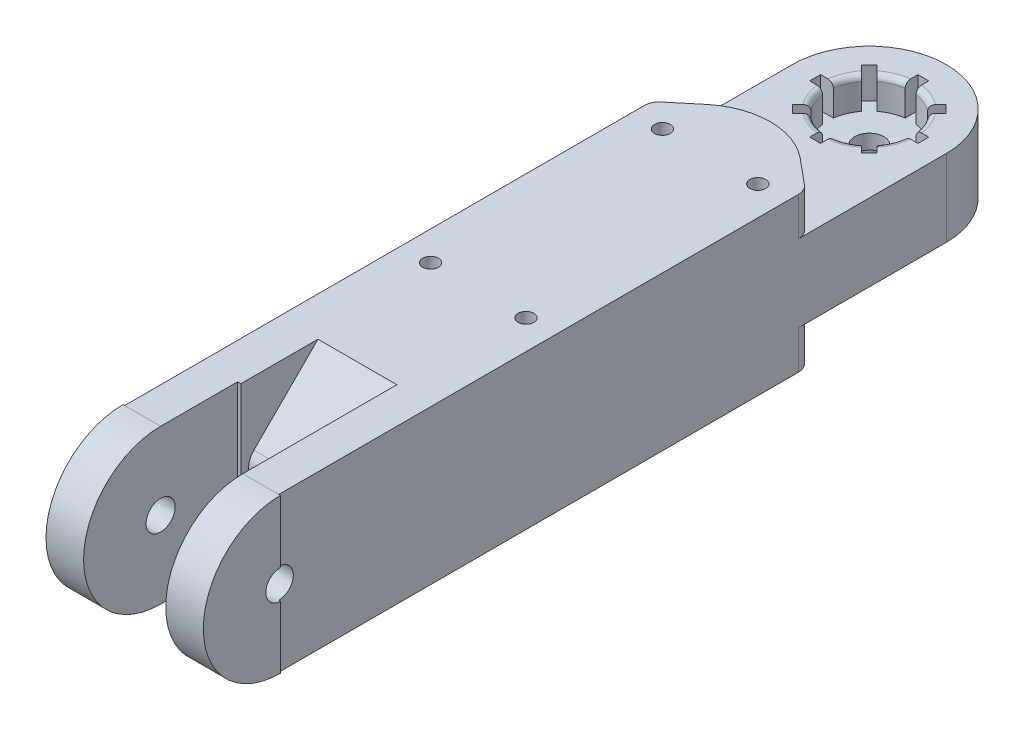
from build123d import *

# Parameters (mm, degrees)
SKETCH1_W                = 42
SKETCH1_H                = 42
BOSS_EXTRUDE1_DEPTH      = 140
SKETCH2_W                = 9.8
SKETCH2_H                = 42
BOSS_EXTRUDE2_DEPTH      = 21
BOSS_EXTRUDE4_DEPTH      = 10.25
BOSS_EXTRUDE5_START      = -10.25
BOSS_EXTRUDE5_DEPTH      = 10.25
SKETCH6_R                = 3.975
CUT_EXTRUDE1_DEPTH       = 187.094122691
SKETCH8_R                = 3.975
CUT_EXTRUDE2_DEPTH       = 187.094122691
SKETCH9_W                = 42
SKETCH9_H                = 21
BOSS_EXTRUDE6_DEPTH      = 21
BOSS_EXTRUDE7_DEPTH      = 21
SKETCH11_R               = 11.35
CUT_EXTRUDE3_DEPTH       = 8.5
CUT_EXTRUDE4_DEPTH       = 21.5
FILLET1_R                = 5
CUT_EXTRUDE5_START       = -8.5
SKETCH18_R               = 11.35
CUT_EXTRUDE5_DEPTH       = 8.5
SKETCH19_R               = 3.975
CUT_EXTRUDE6_DEPTH       = 8.5
FILLET4_R                = 1.5
FILLET5_R                = 1.5
SKETCH20_W               = 2.96
SKETCH20_H               = 3.81
CUT_EXTRUDE7_DEPTH       = 8.5
CIRPATTERN1_COUNT        = 8
MIRROR1_COPY_1_SKETCH_W  = 2.96
MIRROR1_COPY_1_SKETCH_H  = 3.81
MIRROR1_COPY_1_DEPTH     = 8.5
MIRROR1_COPY_2_SKETCH_W  = 2.96
MIRROR1_COPY_2_SKETCH_H  = 3.81
MIRROR1_COPY_2_DEPTH     = 8.5
MIRROR1_COPY_3_SKETCH_W  = 2.96
MIRROR1_COPY_3_SKETCH_H  = 3.81
MIRROR1_COPY_3_DEPTH     = 8.5
MIRROR1_COPY_4_SKETCH_W  = 2.96
MIRROR1_COPY_4_SKETCH_H  = 3.81
MIRROR1_COPY_4_DEPTH     = 8.5
MIRROR1_COPY_5_SKETCH_W  = 2.96
MIRROR1_COPY_5_SKETCH_H  = 3.81
MIRROR1_COPY_5_DEPTH     = 8.5
MIRROR1_COPY_6_SKETCH_W  = 2.96
MIRROR1_COPY_6_SKETCH_H  = 3.81
MIRROR1_COPY_6_DEPTH     = 8.5
MIRROR1_COPY_7_SKETCH_W  = 2.96
MIRROR1_COPY_7_SKETCH_H  = 3.81
MIRROR1_COPY_7_DEPTH     = 8.5
MIRROR1_COPY_8_SKETCH_W  = 2.96
MIRROR1_COPY_8_SKETCH_H  = 3.81
MIRROR1_COPY_8_DEPTH     = 8.5
SKETCH25_W               = 34
SKETCH25_H               = 49
CUT_EXTRUDE11_DEPTH      = 32
SKETCH26_W               = 34
SKETCH26_H               = 11.1
CUT_EXTRUDE12_DEPTH      = 27
SKETCH30_R               = 2.15
CUT_EXTRUDE13_DEPTH      = 186.237961837
FILLET10_R               = 3
MIRROR12_COPY_1_SKETCH_R = 2.15
MIRROR12_COPY_1_DEPTH    = 186.237961837
FILLET10_OF_MIRROR12_R   = 3
CUT_EXTRUDE16_DEPTH      = 10.5
FILLET12_R               = 20
FILLET12_OF_MIRROR13_R   = 20
FILLET13_R               = 4


with BuildPart() as part:
    # Sketch1 → Boss-Extrude1 (new body)
    with BuildSketch(Plane.XY):
        Rectangle(SKETCH1_W, SKETCH1_H)
    extrude(amount=BOSS_EXTRUDE1_DEPTH)

    # Sketch2 → Boss-Extrude2 (add)
    with BuildSketch(Plane.XY.offset(140)):
        with Locations((-16.1, 0)):
            Rectangle(SKETCH2_W, SKETCH2_H)
        with Locations((16.1, 0)):
            Rectangle(SKETCH2_W, SKETCH2_H)
    extrude(amount=BOSS_EXTRUDE2_DEPTH)

    # Sketch5 → Boss-Extrude4 (add)
    with BuildSketch(Plane.ZY.offset(-11.2)):
        with BuildLine():
            ThreePointArc((161, -21), (182, 0), (161, 21))
            Line((161, 21), (161, -21))
        make_face()
    extrude(amount=-BOSS_EXTRUDE4_DEPTH)

    # Sketch3 → Boss-Extrude5 (add)
    with BuildSketch(Plane(origin=(-11.2, 0, 0), x_dir=(0, 0, -1), z_dir=(1, 0, 0)).offset(BOSS_EXTRUDE5_START)):
        with BuildLine():
            Line((-161, -21), (-161, 21))
            ThreePointArc((-161, 21), (-182, 0), (-161, -21))
        make_face()
    extrude(amount=BOSS_EXTRUDE5_DEPTH)

    # Sketch6 → Cut-Extrude1 (cut, through all)
    with BuildSketch(Plane.ZY.offset(-11.2)):
        with Locations((161, 0)):
            Circle(SKETCH6_R)
    extrude(amount=-CUT_EXTRUDE1_DEPTH, mode=Mode.SUBTRACT)

    # Sketch8 → Cut-Extrude2 (cut, through all)
    with BuildSketch(Plane(origin=(-11.2, 0, 0), x_dir=(0, 0, -1), z_dir=(1, 0, 0))):
        with Locations((-161, 0)):
            Circle(SKETCH8_R)
    extrude(amount=-CUT_EXTRUDE2_DEPTH, mode=Mode.SUBTRACT)

    # Sketch9 → Boss-Extrude6 (add)
    with BuildSketch(Plane(origin=(0, 0, 0), x_dir=(-1, 0, 0), z_dir=(0, 0, -1))):
        Rectangle(SKETCH9_W, SKETCH9_H)
    extrude(amount=BOSS_EXTRUDE6_DEPTH)

    # Sketch10 → Boss-Extrude7 (add)
    with BuildSketch(Plane(origin=(0, -10.5, 0), x_dir=(-1, 0, 0), z_dir=(0, -1, 0))):
        with BuildLine():
            Line((-21, 21), (21, 21))
            ThreePointArc((21, 21), (0, 42), (-21, 21))
        make_face()
    extrude(amount=-BOSS_EXTRUDE7_DEPTH)

    # Sketch11 → Cut-Extrude3 (cut)
    with BuildSketch(Plane(origin=(0, -10.5, 0), x_dir=(-1, 0, 0), z_dir=(0, -1, 0))):
        with Locations((0, 21)):
            Circle(SKETCH11_R)
    extrude(amount=-CUT_EXTRUDE3_DEPTH, mode=Mode.SUBTRACT)

    # Sketch16 → Cut-Extrude4 (cut)
    with BuildSketch(Plane.ZY.offset(-11.2)):
        Polygon((140, -21), (140, 0), (119, -21), align=None)
        Polygon((140, 0), (140, 21), (119, 21), align=None)
    extrude(amount=CUT_EXTRUDE4_DEPTH, mode=Mode.SUBTRACT)

    # Fillet1
    fillet1_edges = [part.edges().sort_by_distance(p)[0] for p in [
        (0.45, 0, 140),
    ]]
    fillet(fillet1_edges, radius=FILLET1_R)

    # Sketch18 → Cut-Extrude5 (cut)
    with BuildSketch(Plane(origin=(0, 10.5, 0), x_dir=(1, 0, 0), z_dir=(0, 1, 0)).offset(CUT_EXTRUDE5_START)):
        with Locations((0, 21)):
            Circle(SKETCH18_R)
    extrude(amount=CUT_EXTRUDE5_DEPTH, mode=Mode.SUBTRACT)

    # Sketch19 → Cut-Extrude6 (cut)
    with BuildSketch(Plane.XZ.offset(2)):
        with Locations((0, -21)):
            Circle(SKETCH19_R)
    extrude(amount=-CUT_EXTRUDE6_DEPTH, mode=Mode.SUBTRACT)

    # Fillet4
    fillet4_edges = [part.edges().sort_by_distance(p)[0] for p in [
        (11.35, -10.5, -21),
    ]]
    fillet(fillet4_edges, radius=FILLET4_R)

    # Fillet5
    fillet5_edges = [part.edges().sort_by_distance(p)[0] for p in [
        (-11.35, 10.5, -21),
    ]]
    fillet(fillet5_edges, radius=FILLET5_R)

    # Sketch20 → Cut-Extrude7 (cut)
    with BuildSketch(Plane(origin=(0, 10.5, 0), x_dir=(1, 0, 0), z_dir=(0, 1, 0))):
        with Locations((0, 33.85)):
            Rectangle(SKETCH20_W, SKETCH20_H)
    cut_extrude7 = extrude(amount=-CUT_EXTRUDE7_DEPTH, mode=Mode.SUBTRACT)

    # CirPattern1: Cut-Extrude7 ×8 about axis
    cirpattern1_axis = Axis((0, 2, -21), (0, 1, 0))
    for i in range(1, CIRPATTERN1_COUNT):
        add(cut_extrude7.rotate(cirpattern1_axis, i * 360 / CIRPATTERN1_COUNT), mode=Mode.SUBTRACT)

    # Mirror1 copy 1 sketch → Mirror1 copy 1 (cut)
    with BuildSketch(Plane(origin=(14.849242405, -10.5, -6.150757595), x_dir=(0.7071067811865476, 0, -0.7071067811865475), z_dir=(0, -1, 0))):
        with Locations((0, -33.85)):
            Rectangle(MIRROR1_COPY_1_SKETCH_W, MIRROR1_COPY_1_SKETCH_H)
    extrude(amount=-MIRROR1_COPY_1_DEPTH, mode=Mode.SUBTRACT)

    # Mirror1 copy 2 sketch → Mirror1 copy 2 (cut)
    with BuildSketch(Plane(origin=(21, -10.5, -21), x_dir=(0, 0, -1), z_dir=(0, -1, 0))):
        with Locations((0, -33.85)):
            Rectangle(MIRROR1_COPY_2_SKETCH_W, MIRROR1_COPY_2_SKETCH_H)
    extrude(amount=-MIRROR1_COPY_2_DEPTH, mode=Mode.SUBTRACT)

    # Mirror1 copy 3 sketch → Mirror1 copy 3 (cut)
    with BuildSketch(Plane(origin=(14.849242405, -10.5, -35.849242405), x_dir=(-0.7071067811865475, 0, -0.7071067811865476), z_dir=(0, -1, 0))):
        with Locations((0, -33.85)):
            Rectangle(MIRROR1_COPY_3_SKETCH_W, MIRROR1_COPY_3_SKETCH_H)
    extrude(amount=-MIRROR1_COPY_3_DEPTH, mode=Mode.SUBTRACT)

    # Mirror1 copy 4 sketch → Mirror1 copy 4 (cut)
    with BuildSketch(Plane(origin=(0, -10.5, -42), x_dir=(-1, 0, 0), z_dir=(0, -1, 0))):
        with Locations((0, -33.85)):
            Rectangle(MIRROR1_COPY_4_SKETCH_W, MIRROR1_COPY_4_SKETCH_H)
    extrude(amount=-MIRROR1_COPY_4_DEPTH, mode=Mode.SUBTRACT)

    # Mirror1 copy 5 sketch → Mirror1 copy 5 (cut)
    with BuildSketch(Plane(origin=(-14.849242405, -10.5, -35.849242405), x_dir=(-0.7071067811865477, 0, 0.7071067811865475), z_dir=(0, -1, 0))):
        with Locations((0, -33.85)):
            Rectangle(MIRROR1_COPY_5_SKETCH_W, MIRROR1_COPY_5_SKETCH_H)
    extrude(amount=-MIRROR1_COPY_5_DEPTH, mode=Mode.SUBTRACT)

    # Mirror1 copy 6 sketch → Mirror1 copy 6 (cut)
    with BuildSketch(Plane(origin=(-21, -10.5, -21), x_dir=(0, 0, 1), z_dir=(0, -1, 0))):
        with Locations((0, -33.85)):
            Rectangle(MIRROR1_COPY_6_SKETCH_W, MIRROR1_COPY_6_SKETCH_H)
    extrude(amount=-MIRROR1_COPY_6_DEPTH, mode=Mode.SUBTRACT)

    # Mirror1 copy 7 sketch → Mirror1 copy 7 (cut)
    with BuildSketch(Plane(origin=(-14.849242405, -10.5, -6.150757595), x_dir=(0.7071067811865474, 0, 0.7071067811865477), z_dir=(0, -1, 0))):
        with Locations((0, -33.85)):
            Rectangle(MIRROR1_COPY_7_SKETCH_W, MIRROR1_COPY_7_SKETCH_H)
    extrude(amount=-MIRROR1_COPY_7_DEPTH, mode=Mode.SUBTRACT)

    # Mirror1 copy 8 sketch → Mirror1 copy 8 (cut)
    with BuildSketch(Plane.XZ.offset(10.5)):
        with Locations((0, -33.85)):
            Rectangle(MIRROR1_COPY_8_SKETCH_W, MIRROR1_COPY_8_SKETCH_H)
    extrude(amount=-MIRROR1_COPY_8_DEPTH, mode=Mode.SUBTRACT)

    # Sketch25 → Cut-Extrude11 (cut)
    with BuildSketch(Plane.XZ.offset(21)):
        with Locations((0, 54)):
            Rectangle(SKETCH25_W, SKETCH25_H)
    extrude(amount=-CUT_EXTRUDE11_DEPTH, mode=Mode.SUBTRACT)

    # Sketch26 → Cut-Extrude12 (cut)
    with BuildSketch(Plane.XZ.offset(21)):
        with Locations((0, 23.95)):
            Rectangle(SKETCH26_W, SKETCH26_H)
    cut_extrude12 = extrude(amount=-CUT_EXTRUDE12_DEPTH, mode=Mode.SUBTRACT)

    # Sketch30 → Cut-Extrude13 (cut, through all)
    with BuildSketch(Plane.XZ.offset(-6)):
        with Locations((-13, 22.4)):
            Circle(SKETCH30_R)
    cut_extrude13 = extrude(amount=-CUT_EXTRUDE13_DEPTH, mode=Mode.SUBTRACT)

    # Mirror9: Cut-Extrude13 across plane
    add(cut_extrude13.mirror(Plane.ZY), mode=Mode.SUBTRACT)

    # Fillet10
    fillet10_edges = [part.edges().sort_by_distance(p)[0] for p in [
        (-17, -7.5, 18.4),
        (17, -7.5, 18.4),
    ]]
    fillet(fillet10_edges, radius=FILLET10_R)

    # Mirror12: Cut-Extrude12, Cut-Extrude13 across plane
    add(cut_extrude12.mirror(Plane(origin=(0, 0, 54), x_dir=(1, 0, 0), z_dir=(0, 0, -1))), mode=Mode.SUBTRACT)
    add(cut_extrude13.mirror(Plane(origin=(0, 0, 54), x_dir=(1, 0, 0), z_dir=(0, 0, -1))), mode=Mode.SUBTRACT)

    # Mirror12 copy 1 sketch → Mirror12 copy 1 (cut, through all)
    with BuildSketch(Plane(origin=(0, 6, 108), x_dir=(-1, 0, 0), z_dir=(0, -1, 0))):
        with Locations((-13, 22.4)):
            Circle(MIRROR12_COPY_1_SKETCH_R)
    extrude(amount=-MIRROR12_COPY_1_DEPTH, mode=Mode.SUBTRACT)

    # Fillet10 of Mirror12
    fillet10_of_mirror12_edges = [part.edges().sort_by_distance(p)[0] for p in [
        (-17, -7.5, 89.6),
        (17, -7.5, 89.6),
    ]]
    fillet(fillet10_of_mirror12_edges, radius=FILLET10_OF_MIRROR12_R)

    # Sketch32 → Cut-Extrude16 (cut)
    with BuildSketch(Plane(origin=(0, 21, 0), x_dir=(1, 0, 0), z_dir=(0, 1, 0))):
        Polygon((21, 0), (0, 0), (21, -17.421516408), align=None)
        Polygon((-21, -17.421516408), (0, 0), (-21, 0), align=None)
    cut_extrude16 = extrude(amount=-CUT_EXTRUDE16_DEPTH, mode=Mode.SUBTRACT)

    # Fillet12
    fillet12_edges = [part.edges().sort_by_distance(p)[0] for p in [
        (0, 15.75, 0),
    ]]
    fillet(fillet12_edges, radius=FILLET12_R)

    # Mirror13: Cut-Extrude16 across plane
    add(cut_extrude16.mirror(Plane.ZX), mode=Mode.SUBTRACT)

    # Fillet12 of Mirror13
    fillet12_of_mirror13_edges = [part.edges().sort_by_distance(p)[0] for p in [
        (0, -15.75, 0),
    ]]
    fillet(fillet12_of_mirror13_edges, radius=FILLET12_OF_MIRROR13_R)

    # Fillet13
    fillet13_edges = [part.edges().sort_by_distance(p)[0] for p in [
        (-21, 15.75, 17.421516408),
        (-21, -15.75, 17.421516408),
        (21, -15.75, 17.421516408),
        (21, 15.75, 17.421516408),
    ]]
    fillet(fillet13_edges, radius=FILLET13_R)


solid = part.part
